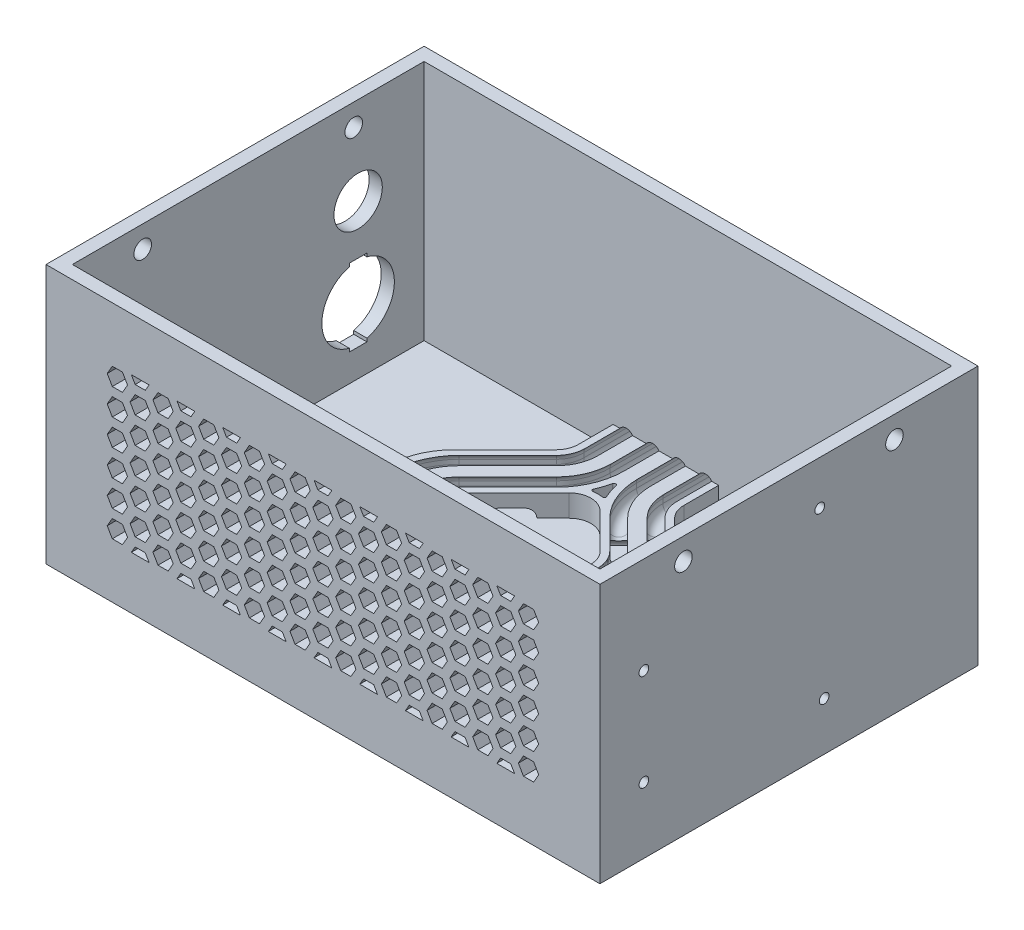
from build123d import *
from OCP.BRepFilletAPI import BRepFilletAPI_MakeFillet

# Parameters (mm, degrees)
SKETCH1_W           = 160.02
SKETCH1_H           = 109.22
SKETCH1_W_2         = 152.4
SKETCH1_H_2         = 101.6
EXTRUDE_THIN1_DEPTH = 69.85
SKETCH2_W           = 160.02
SKETCH2_H           = 109.22
BOSS_EXTRUDE1_DEPTH = 5.08
SKETCH3_R           = 2.54
CUT_EXTRUDE1_DEPTH  = 5.08
SKETCH4_R           = 1.397
CUT_EXTRUDE3_DEPTH  = 5.08
BOSS_EXTRUDE2_DEPTH = 6.35
FILLET1_R1          = 19.05
FILLET1_R2          = 6.35
SKETCH16_R          = 6.985
CUT_EXTRUDE4_DEPTH  = 5.08
SKETCH19_R          = 10.4775
CUT_EXTRUDE5_DEPTH  = 20.32
SKETCH20_R          = 3.4925
CUT_EXTRUDE6_DEPTH  = 20.32
CUT_EXTRUDE7_DEPTH  = 5.08
FILLET2_R           = 0.508
BOSS_EXTRUDE3_START = 1.27
SKETCH22_R          = 2.667
SKETCH22_R_2        = 1.397
BOSS_EXTRUDE3_DEPTH = 1.27
CHAMFER1_SIZE       = 1.27
SKETCH24_R          = 2.54
CUT_EXTRUDE8_DEPTH  = 183.941725694
SKETCH25_W          = 10.16
SKETCH25_H          = 2.54
CUT_EXTRUDE9_DEPTH  = 16.51
SKETCH26_W          = 10.16
SKETCH26_H          = 2.54
CUT_EXTRUDE10_DEPTH = 16.51
FILLET3_R           = 2.54
SKETCH27_W          = 5.08
SKETCH27_H          = 22.225
CUT_EXTRUDE11_DEPTH = 16.51
CUT_EXTRUDE12_DEPTH = 5.08


# Some blends are built 0.0001 mm under size
with BuildPart() as part:
    # Sketch1 → Extrude-Thin1 (new body)
    with BuildSketch(Plane(origin=(0, 0, 0), x_dir=(1, 0, 0), z_dir=(0, 1, 0))):
        Rectangle(SKETCH1_W, SKETCH1_H)
        Rectangle(SKETCH1_W_2, SKETCH1_H_2, mode=Mode.SUBTRACT)
    extrude(amount=EXTRUDE_THIN1_DEPTH)

    # Sketch2 → Boss-Extrude1 (add)
    with BuildSketch(Plane.XZ):
        Rectangle(SKETCH2_W, SKETCH2_H)
    extrude(amount=BOSS_EXTRUDE1_DEPTH)

    # Sketch3 → Cut-Extrude1 (cut)
    with BuildSketch(Plane(origin=(0, 0, 0), x_dir=(1, 0, 0), z_dir=(0, 1, 0))):
        with Locations(Location((-28.575, -41.275, 0), (0, 0, 270))):
            Circle(SKETCH3_R)
        with Locations(Location((-66.675, -41.275, 0), (0, 0, 270))):
            Circle(SKETCH3_R)
        with Locations(Location((-66.675, -3.175, 0), (0, 0, 270))):
            Circle(SKETCH3_R)
        with Locations(Location((-28.575, -3.175, 0), (0, 0, 270))):
            Circle(SKETCH3_R)
        with Locations(Location((-12.7, -3.175, 0), (0, 0, 270))):
            Circle(SKETCH3_R)
        with Locations(Location((25.4, -3.175, 0), (0, 0, 270))):
            Circle(SKETCH3_R)
        with Locations(Location((25.4, -41.275, 0), (0, 0, 270))):
            Circle(SKETCH3_R)
        with Locations(Location((-12.7, -41.275, 0), (0, 0, 270))):
            Circle(SKETCH3_R)
    extrude(amount=-CUT_EXTRUDE1_DEPTH, mode=Mode.SUBTRACT)

    # Sketch4 → Cut-Extrude3 (cut)
    with BuildSketch(Plane(origin=(76.2, 0, 0), x_dir=(0, 0, -1), z_dir=(1, 0, 0))):
        with Locations(Location((-41.91, 41.91, 0), (0, 0, 180))):
            Circle(SKETCH4_R)
        with Locations(Location((-41.91, 13.97, 0), (0, 0, 180))):
            Circle(SKETCH4_R)
        with Locations(Location((8.89, 57.15, 0), (0, 0, 180))):
            Circle(SKETCH4_R)
        with Locations(Location((10.16, 8.89, 0), (0, 0, 180))):
            Circle(SKETCH4_R)
    extrude(amount=CUT_EXTRUDE3_DEPTH, mode=Mode.SUBTRACT)

    # Sketch6 → Boss-Extrude2 (add)
    with BuildSketch(Plane(origin=(0, 0, 0), x_dir=(1, 0, 0), z_dir=(0, 1, 0))):
        Polygon((-6.35, 50.8), (-21.59, 50.8), (-21.59, 38.1), (-43.815, 15.875), (-43.815, 3.175), (-28.575, 3.175), (-28.575, 9.562385309), (-6.35, 31.787385309), align=None)
        Polygon((8.89, 50.8), (-6.35, 50.8), (-6.35, 31.787385309), (10.16, 15.277385309), (10.16, 3.175), (25.4, 3.175), (25.4, 21.59), (8.89, 38.1), align=None)
    extrude(amount=BOSS_EXTRUDE2_DEPTH)

    # Fillet1: one fillet with a radius per group of edges: ONE call of the kernel's fillet builder (fillet() takes one radius for all edges)
    fillet1_edges_1 = [part.edges().sort_by_distance(p)[0] for p in [
        (-43.815, 3.175, -15.875),
        (25.4, 3.175, -21.59),
    ]]
    fillet1_edges_2 = [part.edges().sort_by_distance(p)[0] for p in [
        (-21.59, 3.175, -38.1),
        (-28.575, 3.175, -9.562385309),
        (10.16, 3.175, -15.277385309),
        (8.89, 3.175, -38.1),
        (-6.35, 3.175, -31.787385309),
    ]]
    fillet1 = BRepFilletAPI_MakeFillet(part.part.solid().wrapped)
    for e in fillet1_edges_1:
        fillet1.Add(FILLET1_R1, e.wrapped)
    for e in fillet1_edges_2:
        fillet1.Add(FILLET1_R2, e.wrapped)
    add(Compound.cast(fillet1.Shape()), mode=Mode.REPLACE)

    # Cut-Sweep1: sweep along a path in Sketch7
    with BuildLine(Plane(origin=(0, 6.35, 0), x_dir=(1, 0, 0), z_dir=(0, 1, 0))) as cut_sweep1_path:
        Line((-17.78, 50.8), (-17.78, 40.730256121))
        ThreePointArc((-17.78, 40.730256121), (-18.55338395, 36.842192448), (-20.755795103, 33.546051224))
        Line((-20.755795103, 33.546051224), (-34.797358569, 19.504487758))
        ThreePointArc((-34.797358569, 19.504487758), (-38.651578088, 13.736240616), (-40.005, 6.932129188))
        Line((-40.005, 6.932129188), (-40.005, 3.175))
    # Sketch8 → Cut-Sweep1 (sweep, cut)
    with BuildSketch(Plane.XY.offset(-3.175)):
        with BuildLine():
            Line((-37.7825, 5.08), (-37.7825, 3.81))
            ThreePointArc((-37.7825, 3.81), (-40.005, 1.5875), (-42.2275, 3.81))
            Line((-42.2275, 3.81), (-42.2275, 5.08))
            ThreePointArc((-42.2275, 5.08), (-40.005, 7.3025), (-37.7825, 5.08))
        make_face()
    sweep(path=cut_sweep1_path.line, mode=Mode.SUBTRACT)

    # Cut-Sweep2: sweep along a path in Sketch9
    with BuildLine(Plane(origin=(0, 6.35, 0), x_dir=(1, 0, 0), z_dir=(0, 1, 0))) as cut_sweep2_path:
        Line((-32.385, 3.175), (-32.385, 6.932129188))
        ThreePointArc((-32.385, 6.932129188), (-31.61161605, 10.820192861), (-29.409204897, 14.116334085))
        Line((-29.409204897, 14.116334085), (-15.367641431, 28.157897552))
        ThreePointArc((-15.367641431, 28.157897552), (-11.513421912, 33.926144694), (-10.16, 40.730256121))
        Line((-10.16, 40.730256121), (-10.16, 50.8))
    # Sketch10 → Cut-Sweep2 (sweep, cut)
    with BuildSketch(Plane.XY.offset(-3.175)):
        with BuildLine():
            Line((-30.1625, 5.08), (-30.1625, 3.81))
            ThreePointArc((-30.1625, 3.81), (-32.385, 1.5875), (-34.6075, 3.81))
            Line((-34.6075, 3.81), (-34.6075, 5.08))
            ThreePointArc((-34.6075, 5.08), (-32.385, 7.3025), (-30.1625, 5.08))
        make_face()
    sweep(path=cut_sweep2_path.line, mode=Mode.SUBTRACT)

    # Cut-Sweep3: sweep along a path in Sketch11
    with BuildLine(Plane(origin=(0, 6.35, 0), x_dir=(1, 0, 0), z_dir=(0, 1, 0))) as cut_sweep3_path:
        Line((13.97, 3.175), (13.97, 12.647129188))
        ThreePointArc((13.97, 12.647129188), (13.19661605, 16.535192861), (10.994204897, 19.831334085))
        Line((10.994204897, 19.831334085), (2.667641431, 28.157897552))
        ThreePointArc((2.667641431, 28.157897552), (-1.186578088, 33.926144694), (-2.54, 40.730256121))
        Line((-2.54, 40.730256121), (-2.54, 50.8))
    # Sketch12 → Cut-Sweep3 (sweep, cut)
    with BuildSketch(Plane.XY.offset(-3.175)):
        with BuildLine():
            Line((16.1925, 5.08), (16.1925, 3.81))
            ThreePointArc((16.1925, 3.81), (13.97, 1.5875), (11.7475, 3.81))
            Line((11.7475, 3.81), (11.7475, 5.08))
            ThreePointArc((11.7475, 5.08), (13.97, 7.3025), (16.1925, 5.08))
        make_face()
    sweep(path=cut_sweep3_path.line, mode=Mode.SUBTRACT)

    # Cut-Sweep4: sweep along a path in Sketch13
    with BuildLine(Plane(origin=(0, 6.35, 0), x_dir=(1, 0, 0), z_dir=(0, 1, 0))) as cut_sweep4_path:
        Line((5.08, 50.8), (5.08, 40.730256121))
        ThreePointArc((5.08, 40.730256121), (5.85338395, 36.842192448), (8.055795103, 33.546051224))
        Line((8.055795103, 33.546051224), (17.126307345, 24.475538982))
        ThreePointArc((17.126307345, 24.475538982), (20.429924075, 19.531327146), (21.59, 13.699231637))
        Line((21.59, 13.699231637), (21.59, 3.175))
    # Sketch14 → Cut-Sweep4 (sweep, cut)
    with BuildSketch(Plane.XY.offset(-3.175)):
        with BuildLine():
            Line((23.8125, 5.08), (23.8125, 3.81))
            ThreePointArc((23.8125, 3.81), (21.59, 1.5875), (19.3675, 3.81))
            Line((19.3675, 3.81), (19.3675, 5.08))
            ThreePointArc((19.3675, 5.08), (21.59, 7.3025), (23.8125, 5.08))
        make_face()
    sweep(path=cut_sweep4_path.line, mode=Mode.SUBTRACT)

    # Sketch16 → Cut-Extrude4 (cut)
    with BuildSketch(Plane(origin=(-76.2, 0, 0), x_dir=(0, 0, -1), z_dir=(1, 0, 0))):
        with Locations((31.75, 44.45)):
            Circle(SKETCH16_R)
    extrude(amount=-CUT_EXTRUDE4_DEPTH, mode=Mode.SUBTRACT)

    # Sketch19 → Cut-Extrude5 (cut)
    with BuildSketch(Plane.ZY.offset(80.01)):
        with Locations((-31.75, 19.05)):
            Circle(SKETCH19_R)
    extrude(amount=-CUT_EXTRUDE5_DEPTH, mode=Mode.SUBTRACT)

    # Sketch20 → Cut-Extrude6 (cut)
    with BuildSketch(Plane.XY.offset(-50.8)):
        with Locations((18.716836234, 5.08)):
            Circle(SKETCH20_R)
        with BuildLine():
            Line((-15.5575, 5.08), (-15.5575, 3.81))
            ThreePointArc((-15.5575, 3.81), (-17.78, 1.5875), (-20.0025, 3.81))
            Line((-20.0025, 3.81), (-20.0025, 5.08))
            ThreePointArc((-20.0025, 5.08), (-17.78, 7.3025), (-15.5575, 5.08))
        make_face()
        with BuildLine():
            Line((-12.3825, 5.08), (-12.3825, 3.81))
            ThreePointArc((-12.3825, 3.81), (-10.16, 1.5875), (-7.9375, 3.81))
            Line((-7.9375, 3.81), (-7.9375, 5.08))
            ThreePointArc((-7.9375, 5.08), (-10.16, 7.3025), (-12.3825, 5.08))
        make_face()
        with BuildLine():
            Line((-4.7625, 5.08), (-4.7625, 3.81))
            ThreePointArc((-4.7625, 3.81), (-2.54, 1.5875), (-0.3175, 3.81))
            Line((-0.3175, 3.81), (-0.3175, 5.08))
            ThreePointArc((-0.3175, 5.08), (-2.54, 7.3025), (-4.7625, 5.08))
        make_face()
        with BuildLine():
            Line((2.8575, 5.08), (2.8575, 3.81))
            ThreePointArc((2.8575, 3.81), (5.08, 1.5875), (7.3025, 3.81))
            Line((7.3025, 3.81), (7.3025, 5.08))
            ThreePointArc((7.3025, 5.08), (5.08, 7.3025), (2.8575, 5.08))
        make_face()
    extrude(amount=-CUT_EXTRUDE6_DEPTH, mode=Mode.SUBTRACT)

    # Sketch21 → Cut-Extrude7 (cut)
    with BuildSketch(Plane(origin=(0, 6.35, 0), x_dir=(1, 0, 0), z_dir=(0, 1, 0))):
        with BuildLine():
            ThreePointArc((-4.011410959, 30.856285995), (-6.35, 31.189129188), (-8.688589041, 30.856285995))
            ThreePointArc((-8.688589041, 30.856285995), (-7.085239117, 34.969087966), (-6.35, 39.321707232))
            ThreePointArc((-6.35, 39.321707232), (-5.614760883, 34.969087966), (-4.011410959, 30.856285995))
        make_face()
    extrude(amount=-CUT_EXTRUDE7_DEPTH, mode=Mode.SUBTRACT)

    # Fillet2
    fillet2_edges = [part.edges().sort_by_distance(p)[0] for p in [
        (-8.688589041, 3.81, -30.856285995),
        (-6.35, 3.81, -39.321707232),
        (-4.011410959, 3.81, -30.856285995),
    ]]
    fillet(fillet2_edges, radius=FILLET2_R)

    # Sketch22 → Boss-Extrude3 (add)
    # profile 1 of 4: a face of its own
    with BuildSketch(Plane.ZY.offset(-76.2).offset(BOSS_EXTRUDE3_START)):
        with Locations((-8.89, 57.15)):
            Circle(SKETCH22_R)
        with Locations((-8.89, 57.15)):
            Circle(SKETCH22_R_2, mode=Mode.SUBTRACT)
    # profile 2 of 4: a face of its own
    with BuildSketch(Plane.ZY.offset(-76.2).offset(BOSS_EXTRUDE3_START)):
        with Locations((-10.16, 8.89)):
            Circle(SKETCH22_R)
        with Locations((-10.16, 8.89)):
            Circle(SKETCH22_R_2, mode=Mode.SUBTRACT)
    # profile 3 of 4: a face of its own
    with BuildSketch(Plane.ZY.offset(-76.2).offset(BOSS_EXTRUDE3_START)):
        with Locations((41.91, 13.97)):
            Circle(SKETCH22_R)
        with Locations((41.91, 13.97)):
            Circle(SKETCH22_R_2, mode=Mode.SUBTRACT)
    # profile 4 of 4: a face of its own
    with BuildSketch(Plane.ZY.offset(-76.2).offset(BOSS_EXTRUDE3_START)):
        with Locations((41.91, 41.91)):
            Circle(SKETCH22_R)
        with Locations((41.91, 41.91)):
            Circle(SKETCH22_R_2, mode=Mode.SUBTRACT)
    extrude(amount=-BOSS_EXTRUDE3_DEPTH)

    # Chamfer1
    chamfer1_edges = [part.edges().sort_by_distance(p)[0] for p in [
        (76.2, 57.15, -11.557),
        (76.2, 8.89, -12.827),
        (76.2, 13.97, 39.243),
        (76.2, 41.91, 39.243),
    ]]
    chamfer(chamfer1_edges, length=CHAMFER1_SIZE - 0.0001)  # a hair under: the kernel refuses the full size

    # Sketch24 → Cut-Extrude8 (cut, through all)
    with BuildSketch(Plane(origin=(80.01, 0, 0), x_dir=(0, 0, -1), z_dir=(1, 0, 0))):
        with Locations((-30.48, 63.5)):
            Circle(SKETCH24_R)
        with Locations((30.48, 63.5)):
            Circle(SKETCH24_R)
    extrude(amount=-CUT_EXTRUDE8_DEPTH, mode=Mode.SUBTRACT)

    # Sketch25 → Cut-Extrude9 (cut)
    with BuildSketch(Plane(origin=(-19.068692655, 0, -19.068692655), x_dir=(0.7071067811865485, 0, -0.7071067811865466), z_dir=(0.7071067811865466, 0, 0.7071067811865485))):
        with Locations((0, 1.27)):
            Rectangle(SKETCH25_W, SKETCH25_H)
    extrude(amount=-CUT_EXTRUDE9_DEPTH, mode=Mode.SUBTRACT)

    # Sketch26 → Cut-Extrude10 (cut)
    with BuildSketch(Plane(origin=(12.718692655, 0, -12.718692655), x_dir=(0.7071067811865468, 0, 0.7071067811865482), z_dir=(-0.7071067811865482, 0, 0.7071067811865468))):
        with Locations((-12.181166508, 1.27)):
            Rectangle(SKETCH26_W, SKETCH26_H)
    extrude(amount=-CUT_EXTRUDE10_DEPTH, mode=Mode.SUBTRACT)

    # Fillet3
    # the kernel refuses this fillet: 2.54 mm, written as the material it adds along each edge
    with BuildSketch(Plane(origin=(7.697409662, 2.54, -17.739975647), x_dir=(0, -1, 0), z_dir=(0.7071067811865482, 0, -0.7071067811865468))) as fillet3_piece_1_section:
        with BuildLine():
            CenterArc((FILLET3_R, FILLET3_R), FILLET3_R, 180, 90)
            Line((0, FILLET3_R), (0, 0))
            Line((0, 0), (FILLET3_R, 0))
        make_face()
    fillet3_piece_1 = extrude(amount=8.33610136, mode=Mode.PRIVATE)
    fillet3_piece_1 = fillet3_piece_1 - Plane(origin=(10.344979939, 3.81, -20.480559043), x_dir=(0.7071067811865485, 0, -0.7071067811865467), z_dir=(-0.7071067811865467, 0, -0.7071067811865485)) * Cylinder(2.2225, 27, mode=Mode.PRIVATE)
    add(fillet3_piece_1)
    with BuildSketch(Plane(origin=(12.579203207, 2.54, -22.621769192), x_dir=(0, -1, 0), z_dir=(0.7071067811865482, 0, -0.7071067811865468))) as fillet3_piece_2_section:
        with BuildLine():
            CenterArc((FILLET3_R, FILLET3_R), FILLET3_R, 180, 90)
            Line((0, FILLET3_R), (0, 0))
            Line((0, 0), (FILLET3_R, 0))
        make_face()
    fillet3_piece_2 = extrude(amount=8.33610136, mode=Mode.PRIVATE)
    fillet3_piece_2 = fillet3_piece_2 - Plane(origin=(15.733133612, 3.81, -25.868712716), x_dir=(0.7071067811865467, 1.1988910052195184e-15, -0.7071067811865485), z_dir=(0.7071067811865485, 0, 0.7071067811865467)) * Cylinder(2.2225, 27, mode=Mode.PRIVATE)
    add(fillet3_piece_2)
    with BuildSketch(Plane(origin=(5.394998311, 2.54, -29.805974089), x_dir=(0.7071067811865467, 0, 0.7071067811865483), z_dir=(0.7071067811865482, 0, -0.7071067811865468))) as fillet3_piece_3_section:
        with BuildLine():
            CenterArc((FILLET3_R, FILLET3_R), FILLET3_R, 180, 90)
            Line((0, FILLET3_R), (0, 0))
            Line((0, 0), (FILLET3_R, 0))
        make_face()
    fillet3_piece_3 = extrude(amount=8.33610136, mode=Mode.PRIVATE)
    fillet3_piece_3 = fillet3_piece_3 - Plane(origin=(9.92269742, 3.81, -31.679148908), x_dir=(0.7071067811865467, 1.1988910052195184e-15, -0.7071067811865485), z_dir=(0.7071067811865485, 0, 0.7071067811865467)) * Cylinder(2.2225, 27, mode=Mode.PRIVATE)
    add(fillet3_piece_3)
    with BuildSketch(Plane(origin=(0.513204765, 2.54, -24.924180544), x_dir=(0, -1, 0), z_dir=(0.7071067811865482, 0, -0.7071067811865468))) as fillet3_piece_4_section:
        with BuildLine():
            CenterArc((FILLET3_R, -FILLET3_R), FILLET3_R, 90, 90)
            Line((0, -FILLET3_R), (0, 0))
            Line((0, 0), (FILLET3_R, 0))
        make_face()
    fillet3_piece_4 = extrude(amount=8.33610136, mode=Mode.PRIVATE)
    fillet3_piece_4 = fillet3_piece_4 - Plane(origin=(3.253788161, 3.81, -27.571750821), x_dir=(0.7071067811865485, 0, -0.7071067811865467), z_dir=(-0.7071067811865467, 0, -0.7071067811865485)) * Cylinder(2.2225, 27, mode=Mode.PRIVATE)
    add(fillet3_piece_4)
    with BuildSketch(Plane(origin=(-15.476590206, 2.54, -22.660795103), x_dir=(0, -1, 0), z_dir=(-0.7071067811865466, 0, -0.7071067811865485))) as fillet3_piece_5_section:
        with BuildLine():
            CenterArc((FILLET3_R, FILLET3_R), FILLET3_R, 180, 90)
            Line((0, FILLET3_R), (0, 0))
            Line((0, 0), (FILLET3_R, 0))
        make_face()
    fillet3_piece_5 = extrude(amount=8.33610136, mode=Mode.PRIVATE)
    fillet3_piece_5 = fillet3_piece_5 - Plane(origin=(-18.217173602, 3.81, -25.30836538), x_dir=(0.7071067811865458, 0, 0.7071067811865493), z_dir=(0.7071067811865493, 0, -0.7071067811865458)) * Cylinder(2.2225, 27, mode=Mode.PRIVATE)
    add(fillet3_piece_5)
    with BuildSketch(Plane(origin=(-20.358383751, 2.54, -27.542588648), x_dir=(0, -1, 0), z_dir=(-0.7071067811865466, 0, -0.7071067811865485))) as fillet3_piece_6_section:
        with BuildLine():
            CenterArc((FILLET3_R, FILLET3_R), FILLET3_R, 180, 90)
            Line((0, FILLET3_R), (0, 0))
            Line((0, 0), (FILLET3_R, 0))
        make_face()
    fillet3_piece_6 = extrude(amount=8.33610136, mode=Mode.PRIVATE)
    fillet3_piece_6 = fillet3_piece_6 - Plane(origin=(-23.605327275, 3.81, -30.696519052), x_dir=(0.7071067811865458, 5.794639858561026e-15, 0.7071067811865493), z_dir=(-0.7071067811865493, 0, 0.7071067811865458)) * Cylinder(2.2225, 27, mode=Mode.PRIVATE)
    add(fillet3_piece_6)
    with BuildSketch(Plane(origin=(-27.542588648, 2.54, -20.358383751), x_dir=(0, -1, 0), z_dir=(-0.7071067811865466, 0, -0.7071067811865485))) as fillet3_piece_7_section:
        with BuildLine():
            CenterArc((FILLET3_R, -FILLET3_R), FILLET3_R, 90, 90)
            Line((0, -FILLET3_R), (0, 0))
            Line((0, 0), (FILLET3_R, 0))
        make_face()
    fillet3_piece_7 = extrude(amount=8.33610136, mode=Mode.PRIVATE)
    fillet3_piece_7 = fillet3_piece_7 - Plane(origin=(-30.696519052, 3.81, -23.605327275), x_dir=(0.7071067811865458, 5.794639858561026e-15, 0.7071067811865493), z_dir=(-0.7071067811865493, 0, 0.7071067811865458)) * Cylinder(2.2225, 27, mode=Mode.PRIVATE)
    add(fillet3_piece_7)
    with BuildSketch(Plane(origin=(-22.660795103, 2.54, -15.476590206), x_dir=(0, -1, 0), z_dir=(-0.7071067811865466, 0, -0.7071067811865485))) as fillet3_piece_8_section:
        with BuildLine():
            CenterArc((FILLET3_R, -FILLET3_R), FILLET3_R, 90, 90)
            Line((0, -FILLET3_R), (0, 0))
            Line((0, 0), (FILLET3_R, 0))
        make_face()
    fillet3_piece_8 = extrude(amount=8.33610136, mode=Mode.PRIVATE)
    fillet3_piece_8 = fillet3_piece_8 - Plane(origin=(-25.30836538, 3.81, -18.217173602), x_dir=(0.7071067811865458, 0, 0.7071067811865493), z_dir=(0.7071067811865493, 0, -0.7071067811865458)) * Cylinder(2.2225, 27, mode=Mode.PRIVATE)
    add(fillet3_piece_8)

    # Sketch27 → Cut-Extrude11 (cut)
    with BuildSketch(Plane.ZY.offset(80.01)):
        with Locations((-31.75, 19.05)):
            Rectangle(SKETCH27_W, SKETCH27_H)
    extrude(amount=-CUT_EXTRUDE11_DEPTH, mode=Mode.SUBTRACT)

    # Sketch29 → Cut-Extrude12 (cut)
    with BuildSketch(Plane.XY.offset(54.61)):
        Polygon((-1.466469684, 45.085), (1.466469684, 45.085), (2.932939367, 47.625), (1.466469684, 50.165), (-1.466469684, 50.165), (-2.932939367, 47.625), align=None)
        Polygon((1.466469684, 52.705), (2.566321947, 54.61), (-2.566321947, 54.61), (-1.466469684, 52.705), align=None)
        Polygon((-1.466469684, 37.465), (1.466469684, 37.465), (2.932939367, 40.005), (1.466469684, 42.545), (-1.466469684, 42.545), (-2.932939367, 40.005), align=None)
        Polygon((-1.466469684, 29.845), (1.466469684, 29.845), (2.932939367, 32.385), (1.466469684, 34.925), (-1.466469684, 34.925), (-2.932939367, 32.385), align=None)
        Polygon((2.932939367, 24.765), (1.466469684, 22.225), (-1.466469684, 22.225), (-2.932939367, 24.765), (-1.466469684, 27.305), (1.466469684, 27.305), align=None)
        Polygon((2.932939367, 17.145), (1.466469684, 14.605), (-1.466469684, 14.605), (-2.932939367, 17.145), (-1.466469684, 19.685), (1.466469684, 19.685), align=None)
        Polygon((-2.566321947, 10.16), (2.566321947, 10.16), (1.466469684, 12.065), (-1.466469684, 12.065), align=None)
        Polygon((5.132643893, 10.795), (3.666174209, 13.335), (5.132643893, 15.875), (8.065583261, 15.875), (9.532052944, 13.335), (8.065583261, 10.795), align=None)
        Polygon((5.132643893, 18.415), (3.666174209, 20.955), (5.132643893, 23.495), (8.065583261, 23.495), (9.532052944, 20.955), (8.065583261, 18.415), align=None)
        Polygon((5.132643893, 26.035), (3.666174209, 28.575), (5.132643893, 31.115), (8.065583261, 31.115), (9.532052944, 28.575), (8.065583261, 26.035), align=None)
        Polygon((9.532052944, 36.195), (8.065583261, 38.735), (5.132643893, 38.735), (3.666174209, 36.195), (5.132643893, 33.655), (8.065583261, 33.655), align=None)
        Polygon((9.532052944, 43.815), (8.065583261, 46.355), (5.132643893, 46.355), (3.666174209, 43.815), (5.132643893, 41.275), (8.065583261, 41.275), align=None)
        Polygon((9.532052944, 51.435), (8.065583261, 53.975), (5.132643893, 53.975), (3.666174209, 51.435), (5.132643893, 48.895), (8.065583261, 48.895), align=None)
        Polygon((14.664696837, 52.705), (15.7645491, 54.61), (10.631905207, 54.61), (11.73175747, 52.705), align=None)
        Polygon((11.73175747, 45.085), (14.664696837, 45.085), (16.131166521, 47.625), (14.664696837, 50.165), (11.73175747, 50.165), (10.265287786, 47.625), align=None)
        Polygon((11.73175747, 37.465), (14.664696837, 37.465), (16.131166521, 40.005), (14.664696837, 42.545), (11.73175747, 42.545), (10.265287786, 40.005), align=None)
        Polygon((16.131166521, 24.765), (14.664696837, 22.225), (11.73175747, 22.225), (10.265287786, 24.765), (11.73175747, 27.305), (14.664696837, 27.305), align=None)
        Polygon((16.131166521, 17.145), (14.664696837, 14.605), (11.73175747, 14.605), (10.265287786, 17.145), (11.73175747, 19.685), (14.664696837, 19.685), align=None)
        Polygon((18.330871047, 10.795), (16.864401363, 13.335), (18.330871047, 15.875), (21.263810414, 15.875), (22.730280098, 13.335), (21.263810414, 10.795), align=None)
        Polygon((18.330871047, 18.415), (16.864401363, 20.955), (18.330871047, 23.495), (21.263810414, 23.495), (22.730280098, 20.955), (21.263810414, 18.415), align=None)
        Polygon((18.330871047, 26.035), (16.864401363, 28.575), (18.330871047, 31.115), (21.263810414, 31.115), (22.730280098, 28.575), (21.263810414, 26.035), align=None)
        Polygon((22.730280098, 36.195), (21.263810414, 38.735), (18.330871047, 38.735), (16.864401363, 36.195), (18.330871047, 33.655), (21.263810414, 33.655), align=None)
        Polygon((22.730280098, 43.815), (21.263810414, 46.355), (18.330871047, 46.355), (16.864401363, 43.815), (18.330871047, 41.275), (21.263810414, 41.275), align=None)
        Polygon((22.730280098, 51.435), (21.263810414, 53.975), (18.330871047, 53.975), (16.864401363, 51.435), (18.330871047, 48.895), (21.263810414, 48.895), align=None)
        Polygon((24.929984624, 45.085), (27.862923991, 45.085), (29.329393675, 47.625), (27.862923991, 50.165), (24.929984624, 50.165), (23.46351494, 47.625), align=None)
        Polygon((27.862923991, 52.705), (28.962776254, 54.61), (23.830132361, 54.61), (24.929984624, 52.705), align=None)
        Polygon((24.929984624, 37.465), (27.862923991, 37.465), (29.329393675, 40.005), (27.862923991, 42.545), (24.929984624, 42.545), (23.46351494, 40.005), align=None)
        Polygon((24.929984624, 29.845), (27.862923991, 29.845), (29.329393675, 32.385), (27.862923991, 34.925), (24.929984624, 34.925), (23.46351494, 32.385), align=None)
        Polygon((29.329393675, 24.765), (27.862923991, 22.225), (24.929984624, 22.225), (23.46351494, 24.765), (24.929984624, 27.305), (27.862923991, 27.305), align=None)
        Polygon((29.329393675, 17.145), (27.862923991, 14.605), (24.929984624, 14.605), (23.46351494, 17.145), (24.929984624, 19.685), (27.862923991, 19.685), align=None)
        Polygon((23.830132361, 10.16), (28.962776254, 10.16), (27.862923991, 12.065), (24.929984624, 12.065), align=None)
        Polygon((31.5290982, 10.795), (30.062628517, 13.335), (31.5290982, 15.875), (34.462037568, 15.875), (35.928507252, 13.335), (34.462037568, 10.795), align=None)
        Polygon((11.73175747, 29.845), (14.664696837, 29.845), (16.131166521, 32.385), (14.664696837, 34.925), (11.73175747, 34.925), (10.265287786, 32.385), align=None)
        Polygon((10.631905207, 10.16), (15.7645491, 10.16), (14.664696837, 12.065), (11.73175747, 12.065), align=None)
        Polygon((37.028359514, 10.16), (42.161003408, 10.16), (41.061151145, 12.065), (38.128211777, 12.065), align=None)
        Polygon((42.527620829, 17.145), (41.061151145, 14.605), (38.128211777, 14.605), (36.661742094, 17.145), (38.128211777, 19.685), (41.061151145, 19.685), align=None)
        Polygon((31.5290982, 18.415), (30.062628517, 20.955), (31.5290982, 23.495), (34.462037568, 23.495), (35.928507252, 20.955), (34.462037568, 18.415), align=None)
        Polygon((31.5290982, 26.035), (30.062628517, 28.575), (31.5290982, 31.115), (34.462037568, 31.115), (35.928507252, 28.575), (34.462037568, 26.035), align=None)
        Polygon((42.527620829, 24.765), (41.061151145, 22.225), (38.128211777, 22.225), (36.661742094, 24.765), (38.128211777, 27.305), (41.061151145, 27.305), align=None)
        Polygon((38.128211777, 29.845), (41.061151145, 29.845), (42.527620829, 32.385), (41.061151145, 34.925), (38.128211777, 34.925), (36.661742094, 32.385), align=None)
        Polygon((35.928507252, 36.195), (34.462037568, 38.735), (31.5290982, 38.735), (30.062628517, 36.195), (31.5290982, 33.655), (34.462037568, 33.655), align=None)
        Polygon((35.928507252, 43.815), (34.462037568, 46.355), (31.5290982, 46.355), (30.062628517, 43.815), (31.5290982, 41.275), (34.462037568, 41.275), align=None)
        Polygon((38.128211777, 37.465), (41.061151145, 37.465), (42.527620829, 40.005), (41.061151145, 42.545), (38.128211777, 42.545), (36.661742094, 40.005), align=None)
        Polygon((35.928507252, 51.435), (34.462037568, 53.975), (31.5290982, 53.975), (30.062628517, 51.435), (31.5290982, 48.895), (34.462037568, 48.895), align=None)
        Polygon((38.128211777, 45.085), (41.061151145, 45.085), (42.527620829, 47.625), (41.061151145, 50.165), (38.128211777, 50.165), (36.661742094, 47.625), align=None)
        Polygon((41.061151145, 52.705), (42.161003408, 54.61), (37.028359514, 54.61), (38.128211777, 52.705), align=None)
        Polygon((49.126734405, 51.435), (47.660264722, 53.975), (44.727325354, 53.975), (43.26085567, 51.435), (44.727325354, 48.895), (47.660264722, 48.895), align=None)
        Polygon((49.126734405, 43.815), (47.660264722, 46.355), (44.727325354, 46.355), (43.26085567, 43.815), (44.727325354, 41.275), (47.660264722, 41.275), align=None)
        Polygon((44.727325354, 26.035), (43.26085567, 28.575), (44.727325354, 31.115), (47.660264722, 31.115), (49.126734405, 28.575), (47.660264722, 26.035), align=None)
        Polygon((51.326438931, 45.085), (54.259378298, 45.085), (55.725847982, 47.625), (54.259378298, 50.165), (51.326438931, 50.165), (49.859969247, 47.625), align=None)
        Polygon((49.126734405, 36.195), (47.660264722, 38.735), (44.727325354, 38.735), (43.26085567, 36.195), (44.727325354, 33.655), (47.660264722, 33.655), align=None)
        Polygon((44.727325354, 18.415), (43.26085567, 20.955), (44.727325354, 23.495), (47.660264722, 23.495), (49.126734405, 20.955), (47.660264722, 18.415), align=None)
        Polygon((44.727325354, 10.795), (43.26085567, 13.335), (44.727325354, 15.875), (47.660264722, 15.875), (49.126734405, 13.335), (47.660264722, 10.795), align=None)
        Polygon((55.725847982, 17.145), (54.259378298, 14.605), (51.326438931, 14.605), (49.859969247, 17.145), (51.326438931, 19.685), (54.259378298, 19.685), align=None)
        Polygon((50.226586668, 10.16), (55.359230561, 10.16), (54.259378298, 12.065), (51.326438931, 12.065), align=None)
        Polygon((51.326438931, 37.465), (54.259378298, 37.465), (55.725847982, 40.005), (54.259378298, 42.545), (51.326438931, 42.545), (49.859969247, 40.005), align=None)
        Polygon((51.326438931, 29.845), (54.259378298, 29.845), (55.725847982, 32.385), (54.259378298, 34.925), (51.326438931, 34.925), (49.859969247, 32.385), align=None)
        Polygon((55.725847982, 24.765), (54.259378298, 22.225), (51.326438931, 22.225), (49.859969247, 24.765), (51.326438931, 27.305), (54.259378298, 27.305), align=None)
        Polygon((57.925552508, 26.035), (56.459082824, 28.575), (57.925552508, 31.115), (60.858491875, 31.115), (62.324961559, 28.575), (60.858491875, 26.035), align=None)
        Polygon((54.259378298, 52.705), (55.359230561, 54.61), (50.226586668, 54.61), (51.326438931, 52.705), align=None)
        Polygon((62.324961559, 51.435), (60.858491875, 53.975), (57.925552508, 53.975), (56.459082824, 51.435), (57.925552508, 48.895), (60.858491875, 48.895), align=None)
        Polygon((62.324961559, 43.815), (60.858491875, 46.355), (57.925552508, 46.355), (56.459082824, 43.815), (57.925552508, 41.275), (60.858491875, 41.275), align=None)
        Polygon((57.925552508, 18.415), (56.459082824, 20.955), (57.925552508, 23.495), (60.858491875, 23.495), (62.324961559, 20.955), (60.858491875, 18.415), align=None)
        Polygon((57.925552508, 10.795), (56.459082824, 13.335), (57.925552508, 15.875), (60.858491875, 15.875), (62.324961559, 13.335), (60.858491875, 10.795), align=None)
        Polygon((62.324961559, 36.195), (60.858491875, 38.735), (57.925552508, 38.735), (56.459082824, 36.195), (57.925552508, 33.655), (60.858491875, 33.655), align=None)
    cut_extrude12 = extrude(amount=-CUT_EXTRUDE12_DEPTH, mode=Mode.SUBTRACT)

    # Mirror1: Cut-Extrude12 across plane
    add(cut_extrude12.mirror(Plane(origin=(0, 0, 0), x_dir=(0, 0, 1), z_dir=(1, 0, 0))), mode=Mode.SUBTRACT)


solid = part.part
